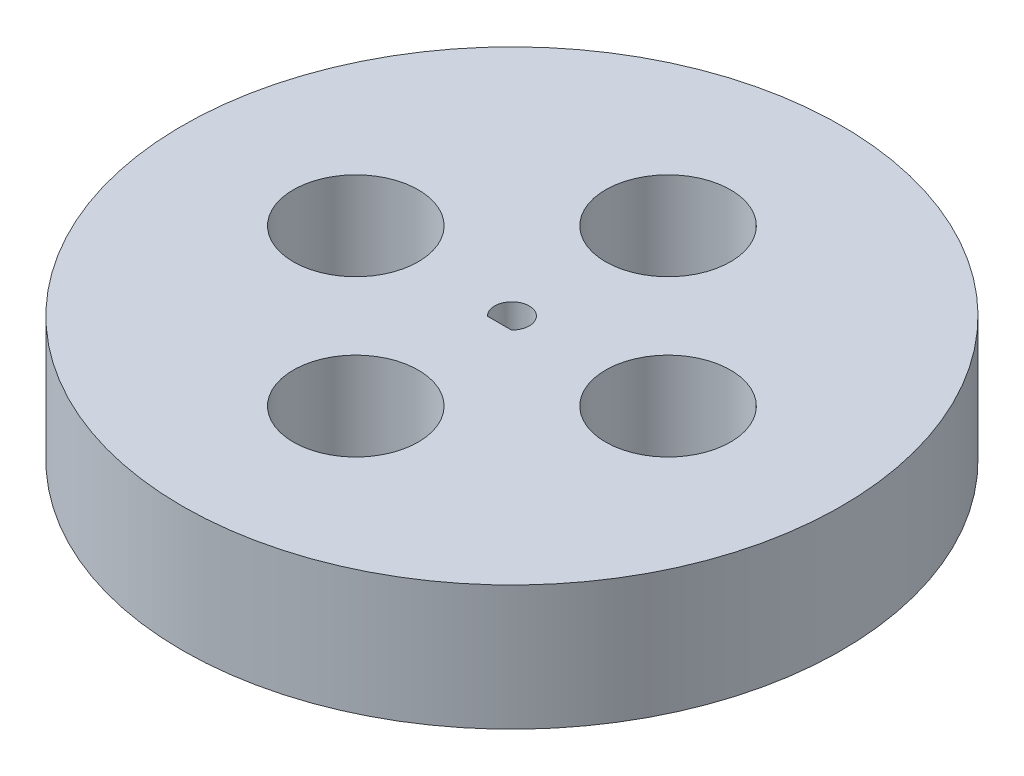
from build123d import *

# Parameters (mm, degrees)
SKETCH1_R           = 52.771281292
BOSS_EXTRUDE1_DEPTH = 20
SKETCH3_R           = 10
CUT_EXTRUDE1_DEPTH  = 20


with BuildPart() as part:
    # Sketch1 → Boss-Extrude1 (new body)
    with BuildSketch(Plane(origin=(0, 0, 0), x_dir=(1, 0, 0), z_dir=(0, 1, 0))):
        Circle(SKETCH1_R)
        with BuildLine():
            Line((1.918332609, -2), (-1.918332609, -2))
            ThreePointArc((-1.918332609, -2), (0, 2.771281292), (1.918332609, -2))
        make_face(mode=Mode.SUBTRACT)
    extrude(amount=BOSS_EXTRUDE1_DEPTH)

    # Sketch3 → Cut-Extrude1 (cut)
    with BuildSketch(Plane(origin=(0, 20, 0), x_dir=(1, 0, 0), z_dir=(0, 1, 0))):
        with Locations((-25, 0)):
            Circle(SKETCH3_R)
        with Locations((0, 25)):
            Circle(SKETCH3_R)
        with Locations((25, 0)):
            Circle(SKETCH3_R)
        with Locations((0, -25)):
            Circle(SKETCH3_R)
    extrude(amount=-CUT_EXTRUDE1_DEPTH, mode=Mode.SUBTRACT)


solid = part.part
